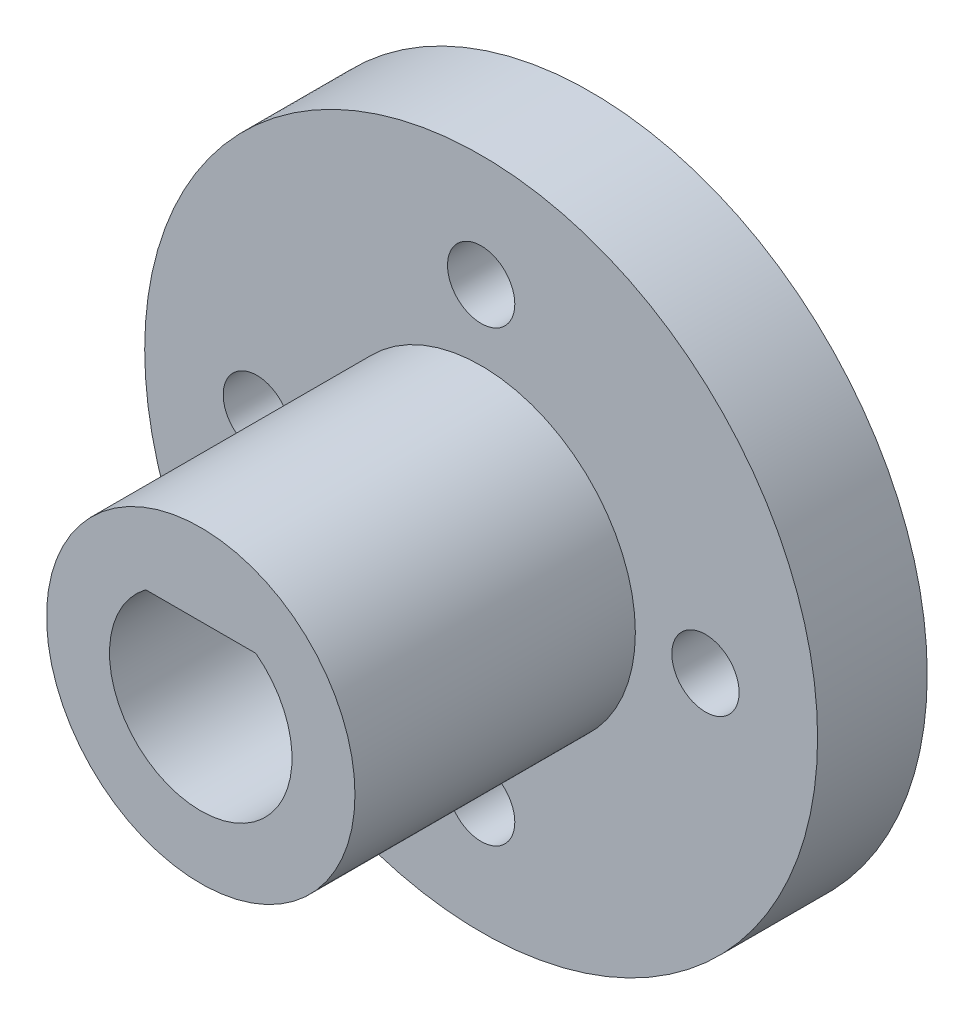
from build123d import *

# Parameters (mm, degrees)
ESQUISSE1_R                  = 12
BOSS_EXTRU_1_DEPTH           = 3.91
ESQUISSE6_R                  = 4.15
ENL_V_MAT_EXTRU_2_DEPTH      = 2.5
ESQUISSE7_R                  = 5.5
BOSS_EXTRU_2_DEPTH           = 10
D_GAGEMENT_M21_D             = 2.4
R_P_TITION_CIRCULAIRE2_COUNT = 4


with BuildPart() as part:
    # Esquisse1 → Boss.-Extru.1 (new body)
    with BuildSketch(Plane.XY):
        Circle(ESQUISSE1_R)
    extrude(amount=BOSS_EXTRU_1_DEPTH)

    # Esquisse6 → Enlèv. mat.-Extru.2 (cut)
    with BuildSketch(Plane(origin=(0, 0, 0), x_dir=(-1, 0, 0), z_dir=(0, 0, -1))):
        Circle(ESQUISSE6_R)
    extrude(amount=-ENL_V_MAT_EXTRU_2_DEPTH, mode=Mode.SUBTRACT)

    # Esquisse7 → Boss.-Extru.2 (add)
    with BuildSketch(Plane.XY.offset(3.91)):
        Circle(ESQUISSE7_R)
        with BuildLine():
            Line((-1.964942747, 2.595), (1.964942747, 2.595))
            ThreePointArc((1.964942747, 2.595), (0, -3.255), (-1.964942747, 2.595))
        make_face(mode=Mode.SUBTRACT)
    extrude(amount=BOSS_EXTRU_2_DEPTH)

    # Dégagement M21 (through all)
    with Locations(Plane.XY.offset(3.91)):
        with Locations((0, 8)):
            d_gagement_m21 = Hole(D_GAGEMENT_M21_D / 2)

    # Répétition circulaire2: Dégagement M21 ×4 about axis
    r_p_tition_circulaire2_axis = Axis((0, 0, 3.91), (0, 0, 1))
    for i in range(1, R_P_TITION_CIRCULAIRE2_COUNT):
        add(d_gagement_m21.rotate(r_p_tition_circulaire2_axis, i * 360 / R_P_TITION_CIRCULAIRE2_COUNT), mode=Mode.SUBTRACT)


solid = part.part
